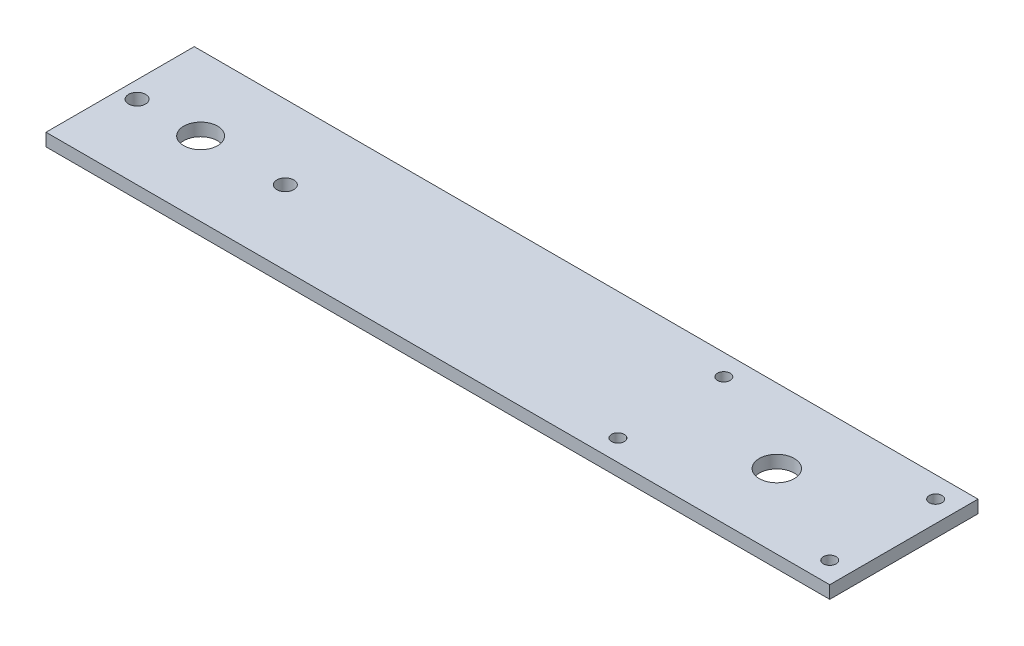
from build123d import *

# Parameters (mm, degrees)
SKETCH1_W           = 185
SKETCH1_H           = 35
SKETCH1_R           = 4.125
SKETCH1_R_2         = 2
SKETCH1_R_3         = 4
BOSS_EXTRUDE1_DEPTH = 3
SKETCH6_R           = 1.5
CUT_EXTRUDE6_DEPTH  = 95.188640504


with BuildPart() as part:
    # Sketch1 → Boss-Extrude1 (new body)
    with BuildSketch(Plane(origin=(0, 0, 0), x_dir=(1, 0, 0), z_dir=(0, 1, 0))):
        Rectangle(SKETCH1_W, SKETCH1_H)
        with Locations((62.5, 0)):
            Circle(SKETCH1_R, mode=Mode.SUBTRACT)
        with Locations((-88.5, 0)):
            Circle(SKETCH1_R_2, mode=Mode.SUBTRACT)
        with Locations((-53.5, 0)):
            Circle(SKETCH1_R_2, mode=Mode.SUBTRACT)
        with Locations((-73.5, 0)):
            Circle(SKETCH1_R_3, mode=Mode.SUBTRACT)
    extrude(amount=BOSS_EXTRUDE1_DEPTH)

    # Sketch6 → Cut-Extrude6 (cut, through all)
    with BuildSketch(Plane(origin=(0, 3, 0), x_dir=(1, 0, 0), z_dir=(0, 1, 0))):
        with Locations((87.5, 12.5)):
            Circle(SKETCH6_R)
        with Locations((87.5, -12.5)):
            Circle(SKETCH6_R)
        with Locations((37.5, -12.5)):
            Circle(SKETCH6_R)
        with Locations((37.5, 12.5)):
            Circle(SKETCH6_R)
    extrude(amount=-CUT_EXTRUDE6_DEPTH, mode=Mode.SUBTRACT)


solid = part.part
